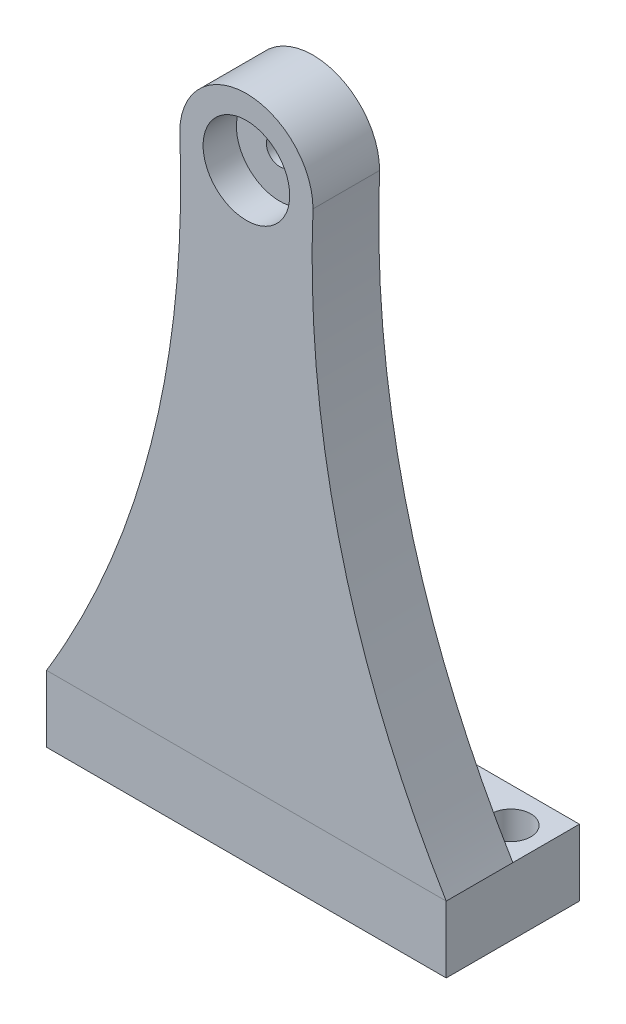
from build123d import *

# Parameters (mm, degrees)
IZIM1_R            = 10
TABAN_FLAN_1_DEPTH = 50
IZIM6_W            = 300
IZIM6_H            = 100
IZIM6_R            = 15
TABAN_FLAN_2_DEPTH = 50
SCALE1_SCALE       = 0.2
SKETCH3_R          = 6.5
CUT_EXTRUDE1_DEPTH = 5


# Sheet-metal steps are written as plain solids
with BuildPart() as part:
    # Çizim1 → Taban-Flanş1 (new body)
    with BuildSketch(Plane.XY):
        with BuildLine():
            Line((-100, 0), (200, 0))
            add(Edge.make_bspline(
                [(200, 0), (91.182830232, 180.87360843), (100, 400)],
                knots=[0, 0, 0, 1, 1, 1], degree=2))
            ThreePointArc((100, 400), (50, 450), (0, 400))
            add(Edge.make_bspline(
                [(-100, 0), (8.817169768, 180.87360843), (0, 400)],
                knots=[0, 0, 0, 1, 1, 1], degree=2))
        make_face()
        with Locations((50, 400)):
            Circle(IZIM1_R, mode=Mode.SUBTRACT)
    extrude(amount=-TABAN_FLAN_1_DEPTH)


with BuildPart() as body_2:
    # Çizim6 → Taban-Flanş2 (new body)
    with BuildSketch(Plane(origin=(0, 0, 0), x_dir=(1, 0, 0), z_dir=(0, 1, 0))):
        with Locations((50, 50)):
            Rectangle(IZIM6_W, IZIM6_H)
        with Locations(Location((-75, 73.5, 0), (0, 0, 270))):
            Circle(IZIM6_R, mode=Mode.SUBTRACT)
        with Locations(Location((175, 73.5, 0), (0, 0, 270))):
            Circle(IZIM6_R, mode=Mode.SUBTRACT)
    extrude(amount=-TABAN_FLAN_2_DEPTH)


with BuildPart() as body_2_1:
    # Scale1: scaled about (0, 0, 0)
    add(body_2.part.scale(SCALE1_SCALE))


with BuildPart() as part_1:
    # Scale1: scaled about (0, 0, 0)
    add(part.part.scale(SCALE1_SCALE))

    # Sketch3 → Cut-Extrude1 (cut)
    with BuildSketch(Plane.XY):
        with Locations((10, 80)):
            Circle(SKETCH3_R)
    extrude(amount=-CUT_EXTRUDE1_DEPTH, mode=Mode.SUBTRACT)


solid = Compound([body_2_1.part, part_1.part])
